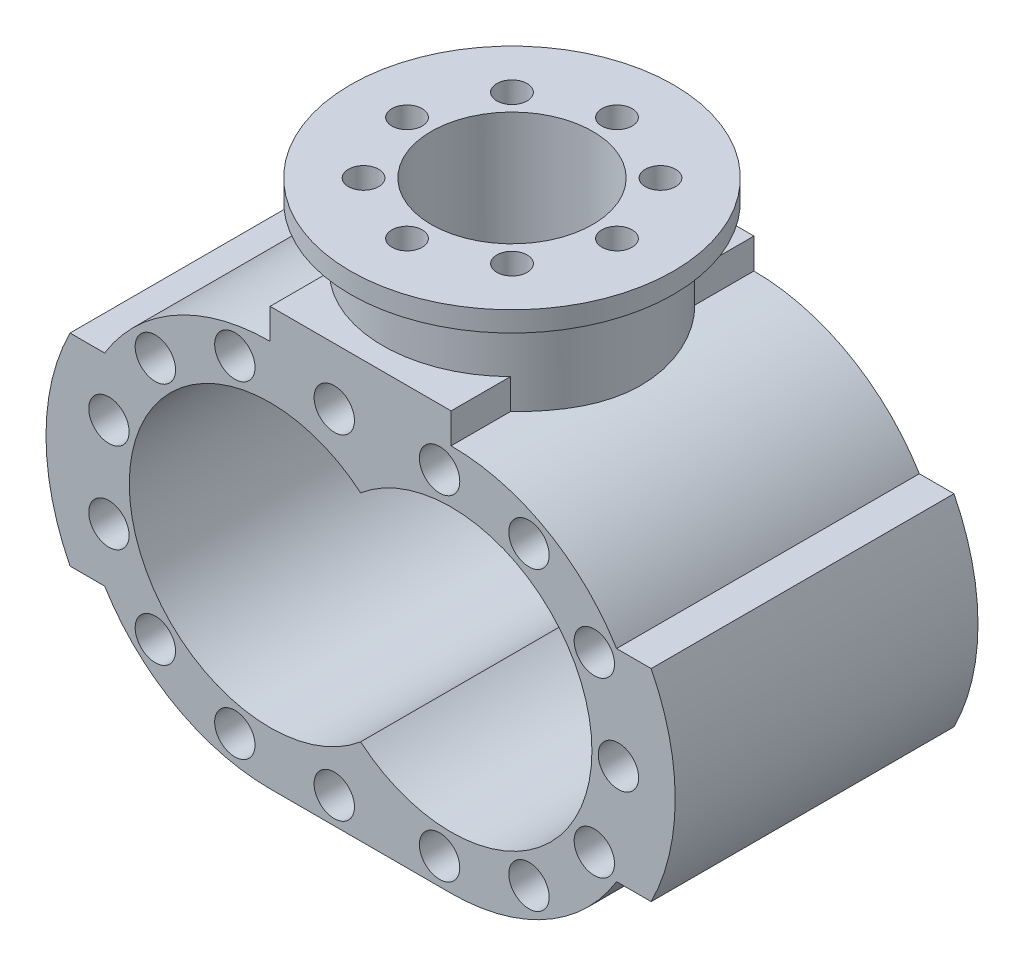
from build123d import *

# Parameters (mm, degrees)
BOSS_EXTRUDE1_DEPTH   = 10
BOSS_EXTRUDE4_DEPTH   = 150
SKETCH2_5_R           = 10
SKETCH2_5_R_2         = 10.25
CUT_EXTRUDE2_DEPTH    = 258.287342
BOSS_EXTRUDE5_START   = -150
SKETCH4_W             = 89.69
SKETCH4_H             = 15
BOSS_EXTRUDE5_DEPTH   = 150
SKETCH5_R             = 10
CUT_EXTRUDE10_DEPTH   = 30
CRVPATTERN1_START     = 120
CRVPATTERN1_OUTLINE_R = 10
CRVPATTERN1_DEPTH     = 30
BOSS_EXTRUDE6_START   = -16.9304
SKETCH7_R             = 64
SKETCH7_R_2           = 40
BOSS_EXTRUDE6_DEPTH   = 46.9304
CUT_EXTRUDE11_REACH   = 327.001
SKETCH8_R             = 80
SKETCH8_R_2           = 40
BOSS_EXTRUDE7_DEPTH   = 10
SKETCH9_R             = 7.5
CUT_EXTRUDE12_DEPTH   = 40
CIRPATTERN1_COUNT     = 8


# Read off the part's stored shape, not the designer's step: CrvPattern1
with BuildPart() as part:
    # Sketch1 → Boss-Extrude1 (new body)
    with BuildSketch(Plane.XY):
        with BuildLine():
            Line((0, 96), (89.69, 96))
            ThreePointArc((89.69, 96), (185.69, 0), (89.69, -96))
            Line((89.69, -96), (0, -96))
            ThreePointArc((0, -96), (-96, 0), (0, 96))
        make_face()
    extrude(amount=BOSS_EXTRUDE1_DEPTH)

    # Sketch2 → Boss-Extrude4 (add)
    with BuildSketch(Plane.XY):
        with BuildLine():
            ThreePointArc((89.69, -96), (185.69, 0), (89.69, 96))
            Line((89.69, 96), (0, 96))
            ThreePointArc((0, 96), (-96, 0), (0, -96))
            Line((0, -96), (89.69, -96))
        make_face()
        with BuildLine():
            ThreePointArc((44.845, -53.422734), (-69.75, 0), (44.845, 53.422734))
            ThreePointArc((44.845, 53.422734), (119.161374, 63.217882), (159.44, 0))
            ThreePointArc((159.44, 0), (119.161374, -63.217882), (44.845, -53.422734))
        make_face(mode=Mode.SUBTRACT)
    extrude(amount=BOSS_EXTRUDE4_DEPTH)

    # Sketch2<5> → Cut-Extrude2 (cut, through all)
    with BuildSketch(Plane.XY):
        Circle(SKETCH2_5_R)
        with Locations((89.69, 0)):
            Circle(SKETCH2_5_R_2)
    extrude(amount=CUT_EXTRUDE2_DEPTH, mode=Mode.SUBTRACT)

    # Sketch4 → Boss-Extrude5 (add)
    with BuildSketch(Plane.XY.offset(150).offset(BOSS_EXTRUDE5_START)):
        with Locations((44.845, 103.5)):
            Rectangle(SKETCH4_W, SKETCH4_H)
        with BuildLine():
            Line((-81.951205, 50), (-99.100959, 50))
            ThreePointArc((-99.100959, 50), (-111, 0), (-99.100959, -50))
            Line((-99.100959, -50), (-81.951205, -50))
            ThreePointArc((-81.951205, -50), (-96, 0), (-81.951205, 50))
        make_face()
        with BuildLine():
            ThreePointArc((188.790959, -50), (200.69, 0), (188.790959, 50))
            Line((188.790959, 50), (171.641205, 50))
            ThreePointArc((171.641205, 50), (185.69, 0), (171.641205, -50))
            Line((171.641205, -50), (188.790959, -50))
        make_face()
    extrude(amount=BOSS_EXTRUDE5_DEPTH)

    # Sketch5 → Cut-Extrude10 (cut)
    with BuildSketch(Plane.XY.offset(150)):
        with Locations((172.565, 0)):
            Circle(SKETCH5_R)
    extrude(amount=-CUT_EXTRUDE10_DEPTH, mode=Mode.SUBTRACT)

    # CrvPattern1 outline → CrvPattern1 (cut)
    with BuildSketch(Plane.XY.offset(CRVPATTERN1_START)):
        with Locations((160.625249, 42.853892)):
            Circle(CRVPATTERN1_OUTLINE_R)
        with Locations((160.625249, -42.853892)):
            Circle(CRVPATTERN1_OUTLINE_R)
        with Locations((128.246301, -73.359916)):
            Circle(CRVPATTERN1_OUTLINE_R)
        with Locations((83.973289, -82.875)):
            Circle(CRVPATTERN1_OUTLINE_R)
        with Locations((31.802237, -82.875)):
            Circle(CRVPATTERN1_OUTLINE_R)
        with Locations((-17.45238, -81.016542)):
            Circle(CRVPATTERN1_OUTLINE_R)
        with Locations((-56.830927, -60.320074)):
            Circle(CRVPATTERN1_OUTLINE_R)
        with Locations((-79.83428, -22.243054)):
            Circle(CRVPATTERN1_OUTLINE_R)
        with Locations((-79.83428, 22.243054)):
            Circle(CRVPATTERN1_OUTLINE_R)
        with Locations((-56.830927, 60.320074)):
            Circle(CRVPATTERN1_OUTLINE_R)
        with Locations((-17.45238, 81.016542)):
            Circle(CRVPATTERN1_OUTLINE_R)
        with Locations((31.802237, 82.875)):
            Circle(CRVPATTERN1_OUTLINE_R)
        with Locations((83.973289, 82.875)):
            Circle(CRVPATTERN1_OUTLINE_R)
        with Locations((128.246301, 73.359916)):
            Circle(CRVPATTERN1_OUTLINE_R)
    extrude(amount=CRVPATTERN1_DEPTH, mode=Mode.SUBTRACT)

    # Sketch7 → Boss-Extrude6 (add)
    with BuildSketch(Plane(origin=(0, 111, 0), x_dir=(1, 0, 0), z_dir=(0, 1, 0)).offset(BOSS_EXTRUDE6_START)):
        with Locations(Location((44.845, -75, 0), (0, 0, 134.483443))):
            Circle(SKETCH7_R)
        with Locations(Location((44.845, -75, 0), (0, 0, 270))):
            Circle(SKETCH7_R_2, mode=Mode.SUBTRACT)
    extrude(amount=BOSS_EXTRUDE6_DEPTH)

    # Sketch7<2> → Cut-Extrude11 (cut, up to next)
    with BuildSketch(Plane(origin=(0, 111, 0), x_dir=(1, 0, 0), z_dir=(0, 1, 0)), mode=Mode.PRIVATE) as cut_extrude11_sk1:
        with BuildLine():
            ThreePointArc((84.845, -75), (79.637998, -55.265582), (65.372637, -40.669021))
            Line((65.372637, -40.669021), (24.317363, -109.330979))
            ThreePointArc((24.317363, -109.330979), (64.579418, -109.792998), (84.845, -75))
        make_face()
    cut_extrude11_tool1 = extrude(cut_extrude11_sk1.sketch, amount=-CUT_EXTRUDE11_REACH, mode=Mode.PRIVATE) & part.part
    # Sketch7<2> → Cut-Extrude11 (cut, up to next)
    with BuildSketch(Plane(origin=(0, 111, 0), x_dir=(1, 0, 0), z_dir=(0, 1, 0)), mode=Mode.PRIVATE) as cut_extrude11_sk2:
        with BuildLine():
            Line((24.317363, -109.330979), (65.372637, -40.669021))
            ThreePointArc((65.372637, -40.669021), (10.514021, -54.472363), (24.317363, -109.330979))
        make_face()
    cut_extrude11_tool2 = extrude(cut_extrude11_sk2.sketch, amount=-CUT_EXTRUDE11_REACH, mode=Mode.PRIVATE) & part.part
    # Sketch7<2> → Cut-Extrude11 (cut, up to next)
    with BuildSketch(Plane(origin=(0, 111, 0), x_dir=(1, 0, 0), z_dir=(0, 1, 0)), mode=Mode.PRIVATE) as cut_extrude11_sk3:
        with BuildLine():
            ThreePointArc((84.845, -75), (79.637998, -55.265582), (65.372637, -40.669021))
            Line((65.372637, -40.669021), (24.317363, -109.330979))
            ThreePointArc((24.317363, -109.330979), (64.579418, -109.792998), (84.845, -75))
        make_face()
    cut_extrude11_tool3 = extrude(cut_extrude11_sk3.sketch, amount=-CUT_EXTRUDE11_REACH, mode=Mode.PRIVATE) & part.part
    # Sketch7<2> → Cut-Extrude11 (cut, up to next)
    with BuildSketch(Plane(origin=(0, 111, 0), x_dir=(1, 0, 0), z_dir=(0, 1, 0)), mode=Mode.PRIVATE) as cut_extrude11_sk4:
        with BuildLine():
            Line((24.317363, -109.330979), (65.372637, -40.669021))
            ThreePointArc((65.372637, -40.669021), (10.514021, -54.472363), (24.317363, -109.330979))
        make_face()
    cut_extrude11_tool4 = extrude(cut_extrude11_sk4.sketch, amount=-CUT_EXTRUDE11_REACH, mode=Mode.PRIVATE) & part.part
    add(cut_extrude11_tool1.solids().sort_by_distance((59.41552, 111, 83.7122))[0], mode=Mode.SUBTRACT)
    add(cut_extrude11_tool2.solids().sort_by_distance((30.27448, 111, 66.2878))[0], mode=Mode.SUBTRACT)
    add(cut_extrude11_tool3.solids().sort_by_distance((59.41552, 111, 83.7122))[0], mode=Mode.SUBTRACT)
    add(cut_extrude11_tool4.solids().sort_by_distance((30.27448, 111, 66.2878))[0], mode=Mode.SUBTRACT)

    # Sketch8 → Boss-Extrude7 (add)
    with BuildSketch(Plane(origin=(0, 141, 0), x_dir=(1, 0, 0), z_dir=(0, 1, 0))):
        with Locations(Location((44.845, -75, 0), (0, 0, 270))):
            Circle(SKETCH8_R)
        with Locations(Location((44.845, -75, 0), (0, 0, 270))):
            Circle(SKETCH8_R_2, mode=Mode.SUBTRACT)
    extrude(amount=BOSS_EXTRUDE7_DEPTH)

    # Sketch9 → Cut-Extrude12 (cut)
    with BuildSketch(Plane(origin=(0, 151, 0), x_dir=(1, 0, 0), z_dir=(0, 1, 0))):
        with Locations(Location((-7.155, -75, 0), (0, 0, 270))):
            Circle(SKETCH9_R)
    cut_extrude12 = extrude(amount=-CUT_EXTRUDE12_DEPTH, mode=Mode.SUBTRACT)

    # CirPattern1: Cut-Extrude12 ×8 about axis
    cirpattern1_axis = Axis((44.845, 0, 75), (0, 1, 0))
    for i in range(1, CIRPATTERN1_COUNT):
        add(cut_extrude12.rotate(cirpattern1_axis, i * 360 / CIRPATTERN1_COUNT), mode=Mode.SUBTRACT)


solid = part.part
